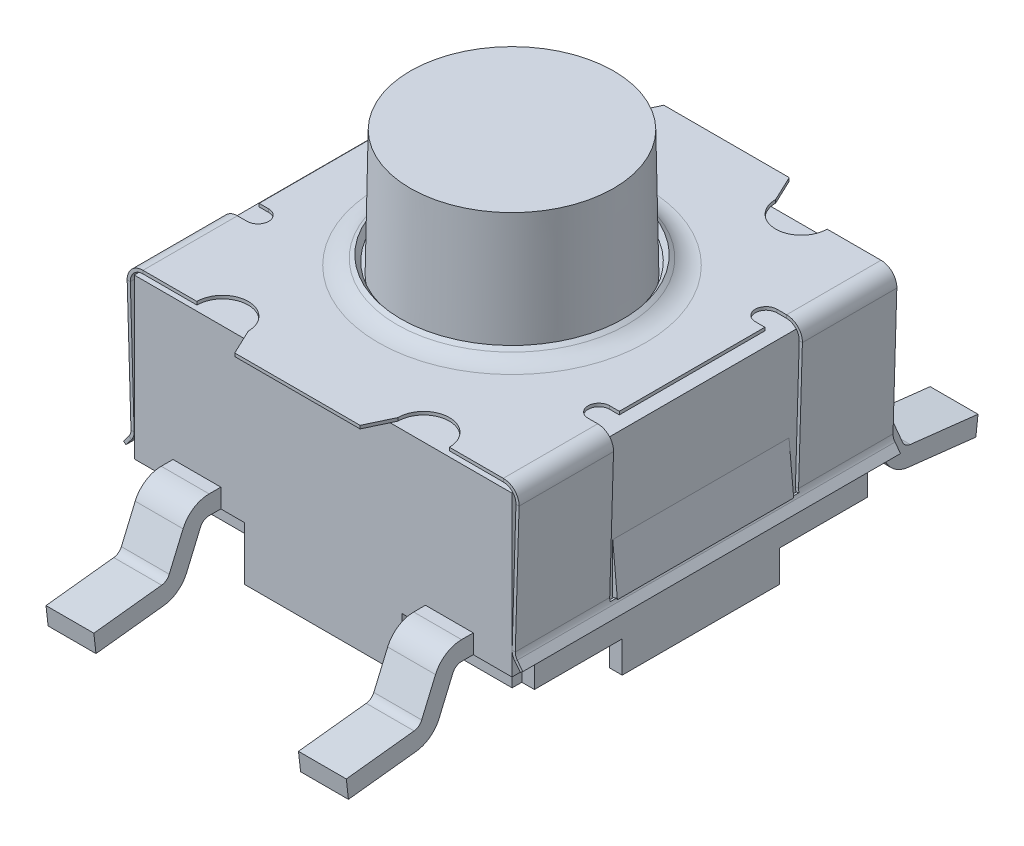
from build123d import *
from OCP.BRepAlgoAPI import BRepAlgoAPI_Cut
from OCP.TopTools import TopTools_ListOfShape

# Parameters (mm, degrees)
BOSS_EXTRUDE1_DEPTH    = 6
SKETCH3_W              = 2.5
SKETCH3_H              = 0.2
SKETCH3_W_2            = 0.2
SKETCH3_H_2            = 2.5
BOSS_EXTRUDE2_DEPTH    = 1
BOSS_EXTRUDE3_DEPTH    = 0.5
SKETCH5_R              = 1.25
CUT_EXTRUDE2_DEPTH     = 0.1
BOSS_EXTRUDE4_DEPTH    = 6
CUT_EXTRUDE4_DEPTH     = 8.069151293
MIRROR2_START          = -2.385
MIRROR2_DEPTH          = 0.76
MIRROR2_START_2        = 1.625
MIRROR2_2_DEPTH        = 0.76
BOSS_EXTRUDE5_DEPTH    = 6
CUT_EXTRUDE5_DEPTH     = 0.073968806
BOSS_EXTRUDE6_DEPTH    = 6
BOSS_EXTRUDE7_DEPTH    = 0.049999147
CUT_EXTRUDE7_START     = -2.364304791
CUT_EXTRUDE7_OUTLINE_R = 1.8
CUT_EXTRUDE7_DEPTH     = 2.364304791
CONVERT_SOLID1_DEPTH   = 6
FILLET1_R              = 0.5
SKETCH17_R             = 1.65
BOSS_EXTRUDE8_DEPTH    = 2
BOSS_EXTRUDE8_TAPER    = 1
CUT_EXTRUDE8_DEPTH     = 0.35


with BuildPart() as part:
    # Sketch1 → Boss-Extrude1 (new body)
    with BuildSketch(Plane.XY):
        Polygon((3, 2.25), (-3, 2.25), (-3, -0.13), (0, -0.13), (3, -0.13), align=None)
    extrude(amount=BOSS_EXTRUDE1_DEPTH)

    # Sketch3 → Boss-Extrude2 (add)
    with BuildSketch(Plane.XZ.offset(0.13)):
        with Locations((0, 5.9)):
            Rectangle(SKETCH3_W, SKETCH3_H)
        with Locations((0, 0.1)):
            Rectangle(SKETCH3_W, SKETCH3_H)
        with Locations((2.9, 3)):
            Rectangle(SKETCH3_W_2, SKETCH3_H_2)
        with Locations((-2.9, 3)):
            Rectangle(SKETCH3_W_2, SKETCH3_H_2)
    extrude(amount=BOSS_EXTRUDE2_DEPTH)



with BuildPart() as body_2:
    # Sketch4 → Boss-Extrude3 (new body)
    with BuildSketch(Plane.XZ.offset(0.13)):
        Polygon((2.8, 4.25), (3, 4.25), (3, 6), (1.25, 6), (1.25, 5.8), (-1.25, 5.8), (-1.25, 6), (-3, 6), (-3, 4.25), (-2.8, 4.25), (-2.8, 1.75), (-3, 1.75), (-3, 0), (-1.25, 0), (-1.25, 0.2), (1.25, 0.2), (1.25, 0), (3, 0), (3, 1.75), (2.8, 1.75), align=None)
    extrude(amount=BOSS_EXTRUDE3_DEPTH)

    # Sketch5 → Cut-Extrude2 (cut)
    with BuildSketch(Plane.XZ.offset(0.63)):
        with Locations((0, 3)):
            Circle(SKETCH5_R)
    extrude(amount=-CUT_EXTRUDE2_DEPTH, mode=Mode.SUBTRACT)


with BuildPart() as body_3:
    # Sketch6 → Boss-Extrude4 (new body)
    with BuildSketch(Plane.ZY.offset(3)):
        with BuildLine():
            Line((0, 0.02), (-0.18604976, 0.02))
            ThreePointArc((-0.18604976, 0.02), (-0.434163434, -0.054580761), (-0.600034856, -0.253601755))
            Line((-0.600034856, -0.253601755), (-0.819482638, -0.768618847))
            ThreePointArc((-0.819482638, -0.768618847), (-0.86784143, -0.830091392), (-0.940571107, -0.858863613))
            Line((-0.940571107, -0.858863613), (-2.016906563, -0.980955818))
            Line((-2.016906563, -0.980955818), (-1.983093437, -1.279044182))
            Line((-1.983093437, -1.279044182), (-0.906757982, -1.156951977))
            ThreePointArc((-0.906757982, -1.156951977), (-0.688568951, -1.070635314), (-0.543492575, -0.886217677))
            Line((-0.543492575, -0.886217677), (-0.324044792, -0.371200585))
            ThreePointArc((-0.324044792, -0.371200585), (-0.268754318, -0.304860254), (-0.18604976, -0.28))
            Line((-0.18604976, -0.28), (0, -0.28))
            Line((0, -0.28), (0, 0.02))
        make_face()
    extrude(amount=-BOSS_EXTRUDE4_DEPTH)

    # Sketch7 → Cut-Extrude4 (cut, through all)
    with BuildSketch(Plane(origin=(0, 0.02, 0), x_dir=(1, 0, 0), z_dir=(0, 1, 0))):
        Polygon((-3, 0), (-3, 0.18604976), (-3, 0.600034856), (-3, 0.819482638), (-3, 0.940571107), (-3, 2.016906563), (-2.385, 2.016906563), (-2.385, 0.940571107), (-2.385, 0.819482638), (-2.385, 0.600034856), (-2.385, 0.18604976), (-2.385, 0), align=None)
        Polygon((3, 0), (2.385, 0), (2.385, 0.18604976), (2.385, 0.600034856), (2.385, 0.819482638), (2.385, 0.940571107), (2.385, 2.016906563), (3, 2.016906563), (3, 0.940571107), (3, 0.819482638), (3, 0.600034856), (3, 0.18604976), align=None)
        Polygon((-1.625, 0), (-1.625, 0.18604976), (-1.625, 0.600034856), (-1.625, 0.819482638), (-1.625, 0.940571107), (-1.625, 2.016906563), (1.625, 2.016906563), (1.625, 0.940571107), (1.625, 0.819482638), (1.625, 0.600034856), (1.625, 0.18604976), (1.625, 0), align=None)
    extrude(amount=-CUT_EXTRUDE4_DEPTH, mode=Mode.SUBTRACT)


with BuildPart() as cut_extrude4_piece_1:
    # of the separate pieces the step leaves, piece 1, a body of its own (cut_extrude4_pieces)
    add(body_3.part.solids().sort_by_distance((1.625, 0.02, -0.18604976))[0])


with BuildPart() as cut_extrude4_piece_2:
    # of the separate pieces the step leaves, piece 2, a body of its own (cut_extrude4_pieces)
    add(body_3.part.solids().sort_by_distance((-2.385, 0.02, -0.18604976))[0])


with BuildPart() as part_1:
    add(part.part)

    add(body_2.part)  # Mirror2 merges body 2
    # Mirror2: read off the stored shape, not the designer's step
    # Mirror2 outline → Mirror2 (add)
    with BuildSketch(Plane.YZ.offset(MIRROR2_START)):
        with BuildLine():
            ThreePointArc((-0.371200585, 6.324044792), (-0.304860254, 6.268754318), (-0.28, 6.18604976))
            Line((-0.28, 6.18604976), (-0.28, 6))
            Line((-0.28, 6), (0.02, 6))
            Line((0.02, 6), (0.02, 6.18604976))
            ThreePointArc((0.02, 6.18604976), (-0.054580761, 6.434163434), (-0.253601755, 6.600034856))
            Line((-0.253601755, 6.600034856), (-0.768618847, 6.819482638))
            ThreePointArc((-0.768618847, 6.819482638), (-0.830091392, 6.86784143), (-0.858863613, 6.940571107))
            Line((-0.858863613, 6.940571107), (-0.980955818, 8.016906563))
            Line((-0.980955818, 8.016906563), (-1.279044182, 7.983093437))
            Line((-1.279044182, 7.983093437), (-1.156951977, 6.906757982))
            ThreePointArc((-1.156951977, 6.906757982), (-1.070635314, 6.688568951), (-0.886217677, 6.543492575))
            Line((-0.886217677, 6.543492575), (-0.371200585, 6.324044792))
        make_face()
    extrude(amount=MIRROR2_DEPTH)

    # Mirror2 2 outline → Mirror2 2 (add)
    with BuildSketch(Plane.YZ.offset(MIRROR2_START_2)):
        with BuildLine():
            ThreePointArc((-0.371200585, 6.324044792), (-0.304860254, 6.268754318), (-0.28, 6.18604976))
            Line((-0.28, 6.18604976), (-0.28, 6))
            Line((-0.28, 6), (0.02, 6))
            Line((0.02, 6), (0.02, 6.18604976))
            ThreePointArc((0.02, 6.18604976), (-0.054580761, 6.434163434), (-0.253601755, 6.600034856))
            Line((-0.253601755, 6.600034856), (-0.768618847, 6.819482638))
            ThreePointArc((-0.768618847, 6.819482638), (-0.830091392, 6.86784143), (-0.858863613, 6.940571107))
            Line((-0.858863613, 6.940571107), (-0.980955818, 8.016906563))
            Line((-0.980955818, 8.016906563), (-1.279044182, 7.983093437))
            Line((-1.279044182, 7.983093437), (-1.156951977, 6.906757982))
            ThreePointArc((-1.156951977, 6.906757982), (-1.070635314, 6.688568951), (-0.886217677, 6.543492575))
            Line((-0.886217677, 6.543492575), (-0.371200585, 6.324044792))
        make_face()
    extrude(amount=MIRROR2_2_DEPTH)

    # Sketch8 → Boss-Extrude5 (add)
    with BuildSketch(Plane.XY.offset(6)):
        Polygon((-3, 0.81), (-3, 0.02), (-3.073968806, 0.02), align=None)
    boss_extrude5 = extrude(amount=-BOSS_EXTRUDE5_DEPTH)

    # Sketch9 → Cut-Extrude5 (cut)
    with BuildSketch(Plane.ZY.offset(3)):
        Polygon((6, 2.25), (4.4, 2.25), (4.4, -0.63), (6, -0.63), (6, 0.02), (6, 0.81), align=None)
        Polygon((0, 0.81), (0, 2.25), (1.6, 2.25), (1.6, -0.63), (0, -0.63), (0, 0.02), align=None)
    cut_extrude5 = extrude(amount=CUT_EXTRUDE5_DEPTH, mode=Mode.SUBTRACT)

    # Mirror6: Boss-Extrude5, Cut-Extrude5 across plane
    add(boss_extrude5.mirror(Plane(origin=(0, 0, 0), x_dir=(0, 0, 1), z_dir=(1, 0, 0))))
    add(cut_extrude5.mirror(Plane(origin=(0, 0, 0), x_dir=(0, 0, 1), z_dir=(1, 0, 0))), mode=Mode.SUBTRACT)

    # Sketch18 → Cut-Extrude8 (cut)
    with BuildSketch(Plane.XZ.offset(0.63)):
        Polygon((-1.25, 6), (-2.8, 6), (-3.002044941, 6), (-3.002044941, 5.644341337), (-2.8, 5.644341337), (-2.8, 5.798292164), (-1.25, 5.798292164), align=None)
        Polygon((1.25, 5.798292164), (2.8, 5.798292164), (2.8, 5.644341337), (3.002044941, 5.644341337), (3.002044941, 6), (2.8, 6), (1.25, 6), align=None)
        Polygon((2.8, 0.201707836), (2.8, 0.355658663), (3.002044941, 0.355658663), (3.002044941, 0), (2.8, 0), (1.25, 0), (1.25, 0.201707836), align=None)
        Polygon((-3.002044941, 0), (-3.002044941, 0.355658663), (-2.8, 0.355658663), (-2.8, 0.201707836), (-1.25, 0.201707836), (-1.25, 0), (-2.8, 0), align=None)
    extrude(amount=-CUT_EXTRUDE8_DEPTH, mode=Mode.SUBTRACT)


with BuildPart() as body_4:
    # Sketch10 → Boss-Extrude6 (new body)
    with BuildSketch(Plane.XY.offset(6)):
        with BuildLine():
            Line((-3.044139593, -0.036784212), (-3.132323542, -0.150230117))
            Line((-3.132323542, -0.150230117), (-3.171799878, -0.119544308))
            Line((-3.171799878, -0.119544308), (-3.08361593, -0.006098404))
            ThreePointArc((-3.08361593, -0.006098404), (-3.059451033, 0.039408216), (-3.052110916, 0.090407407))
            Line((-3.052110916, 0.090407407), (-3.112531378, 2.126895082))
            ThreePointArc((-3.112531378, 2.126895082), (-3.041510621, 2.308968095), (-2.861180613, 2.384304791))
            Line((-2.861180613, 2.384304791), (0, 2.384304791))
            Line((0, 2.384304791), (2.861180613, 2.384304791))
            ThreePointArc((2.861180613, 2.384304791), (3.041510621, 2.308968095), (3.112531378, 2.126895082))
            Line((3.112531378, 2.126895082), (3.052110916, 0.090407407))
            ThreePointArc((3.052110916, 0.090407407), (3.059451033, 0.039408216), (3.08361593, -0.006098404))
            Line((3.08361593, -0.006098404), (3.171799878, -0.119544308))
            Line((3.171799878, -0.119544308), (3.132323542, -0.150230117))
            Line((3.132323542, -0.150230117), (3.044139593, -0.036784212))
            ThreePointArc((3.044139593, -0.036784212), (3.01191973, 0.023891281), (3.002132907, 0.091890202))
            Line((3.002132907, 0.091890202), (3.062553369, 2.128377878))
            ThreePointArc((3.062553369, 2.128377878), (3.005736764, 2.274036287), (2.861472758, 2.334305645))
            Line((2.861472758, 2.334305645), (0, 2.334305645))
            Line((0, 2.334305645), (-2.861472758, 2.334305645))
            ThreePointArc((-2.861472758, 2.334305645), (-3.005736764, 2.274036287), (-3.062553369, 2.128377878))
            Line((-3.062553369, 2.128377878), (-3.002132907, 0.091890202))
            ThreePointArc((-3.002132907, 0.091890202), (-3.01191973, 0.023891281), (-3.044139593, -0.036784212))
        make_face()
    extrude(amount=-BOSS_EXTRUDE6_DEPTH)

    # Sketch11 → Boss-Extrude7 (add)
    with BuildSketch(Plane(origin=(0, 2.384304791, 0), x_dir=(1, 0, 0), z_dir=(0, 1, 0))):
        Polygon((0.995481425, 0.408138047), (-0.995481425, 0.408138047), (-1.188702055, 0), (1.188702055, 0), align=None)
    boss_extrude7 = extrude(amount=-BOSS_EXTRUDE7_DEPTH)

    # Mirror7: Boss-Extrude7 across plane
    add(boss_extrude7.mirror(Plane.XY.offset(3)))


with BuildPart() as cut_extrude7_tool:
    # Cut-Extrude7: read off the stored shape, not the designer's step
    # Cut-Extrude7 outline → Cut-Extrude7 (new body)
    with BuildSketch(Plane(origin=(0, 2.384304791, 0), x_dir=(1, 0, 0), z_dir=(0, 1, 0)).offset(CUT_EXTRUDE7_START)):
        with BuildLine():
            ThreePointArc((2.708459812, -4.155948831), (2.536434227, -4.327974415), (2.708459812, -4.5))
            Line((2.708459812, -4.5), (3.496660879, -4.5))
            Line((3.496660879, -4.5), (3.496660879, -1.5))
            Line((3.496660879, -1.5), (2.708459812, -1.5))
            ThreePointArc((2.708459812, -1.5), (2.536434227, -1.672025585), (2.708459812, -1.844051169))
            Line((2.708459812, -1.844051169), (2.860755933, -1.844051169))
            Line((2.860755933, -1.844051169), (2.860755933, -4.155948831))
            Line((2.860755933, -4.155948831), (2.708459812, -4.155948831))
        make_face()
        with BuildLine():
            Line((-3.496660879, -4.5), (-2.708459812, -4.5))
            ThreePointArc((-2.708459812, -4.5), (-2.536434227, -4.327974415), (-2.708459812, -4.155948831))
            Line((-2.708459812, -4.155948831), (-2.860755933, -4.155948831))
            Line((-2.860755933, -4.155948831), (-2.860755933, -1.844051169))
            Line((-2.860755933, -1.844051169), (-2.708459812, -1.844051169))
            ThreePointArc((-2.708459812, -1.844051169), (-2.536434227, -1.672025585), (-2.708459812, -1.5))
            Line((-2.708459812, -1.5), (-3.496660879, -1.5))
            Line((-3.496660879, -1.5), (-3.496660879, -4.5))
        make_face()
        with BuildLine():
            Line((-1.188702055, 0), (-2.005, 0))
            ThreePointArc((-2.005, 0), (-1.596851027, -0.408148973), (-1.188702055, 0))
        make_face()
        with BuildLine():
            ThreePointArc((1.188702055, 0), (1.596851027, -0.408148973), (2.005, 0))
            Line((2.005, 0), (1.188702055, 0))
        make_face()
        with BuildLine():
            Line((1.188702055, -6), (2.005, -6))
            ThreePointArc((2.005, -6), (1.596851027, -5.591851027), (1.188702055, -6))
        make_face()
        with BuildLine():
            ThreePointArc((-1.188702055, -6), (-1.596851027, -5.591851027), (-2.005, -6))
            Line((-2.005, -6), (-1.188702055, -6))
        make_face()
        with Locations((0, -3)):
            Circle(CUT_EXTRUDE7_OUTLINE_R)
    extrude(amount=CUT_EXTRUDE7_DEPTH)


with BuildPart() as body_4_1:
    add(body_4.part)

    # Cut-Extrude7: cut by cut_extrude7_tool, with a tolerance
    cut_extrude7_stock = TopTools_ListOfShape()
    cut_extrude7_stock.Append(body_4_1.part.wrapped)
    cut_extrude7_tools = TopTools_ListOfShape()
    cut_extrude7_tools.Append(cut_extrude7_tool.part.wrapped)
    cut_extrude7_cut = BRepAlgoAPI_Cut()
    cut_extrude7_cut.SetArguments(cut_extrude7_stock)
    cut_extrude7_cut.SetTools(cut_extrude7_tools)
    cut_extrude7_cut.SetFuzzyValue(0.00001)
    cut_extrude7_cut.Build()
    add(Compound.cast(cut_extrude7_cut.Shape()).solids(), mode=Mode.REPLACE)

    # Convert-Solid1: read off the stored shape, not the designer's step
    # Convert-Solid1 outline → Convert-Solid1 (add)
    with BuildSketch(Plane.XY):
        with BuildLine():
            Line((-3.067325204, 0.02), (-3.013234433, 0.02))
            Line((-3.013234433, 0.02), (-3.060437061, 0.036489755))
            ThreePointArc((-3.060437061, 0.036489755), (-3.063635346, 0.028142207), (-3.067325204, 0.02))
        make_face()
        with BuildLine():
            Line((3.060437061, 0.036489755), (3.013234433, 0.02))
            Line((3.013234433, 0.02), (3.067325204, 0.02))
            ThreePointArc((3.067325204, 0.02), (3.063635346, 0.028142207), (3.060437061, 0.036489755))
        make_face()
    extrude(amount=CONVERT_SOLID1_DEPTH)

    # Sketch16 → Revolve1 (revolve)
    with BuildSketch(Plane(origin=(0, 0, 0), x_dir=(0, 0, -1), z_dir=(1, 0, 0))):
        Polygon((-1.233956868, 2.528957303), (-1.032652544, 2.38010789), (-1.032652544, 2.334293812), (-1.160584347, 2.334293812), (-1.30015805, 2.4385911), align=None)
    revolve(axis=Axis((0, 2.334305645, 3), (0, 1, 0)))

    # Fillet1
    fillet1_edges = [body_4_1.edges().sort_by_distance(p)[0] for p in [
        (0, 2.384304791, 4.961671555),
    ]]
    fillet(fillet1_edges, radius=FILLET1_R)


with BuildPart() as body_5:
    # Sketch17 → Boss-Extrude8 (new body)
    with BuildSketch(Plane(origin=(0, 2.25, 0), x_dir=(1, 0, 0), z_dir=(0, 1, 0))):
        with Locations((0, -3)):
            Circle(SKETCH17_R)
    extrude(amount=BOSS_EXTRUDE8_DEPTH, taper=BOSS_EXTRUDE8_TAPER)


solid = Compound([cut_extrude4_piece_1.part, cut_extrude4_piece_2.part, part_1.part, body_4_1.part, body_5.part])
